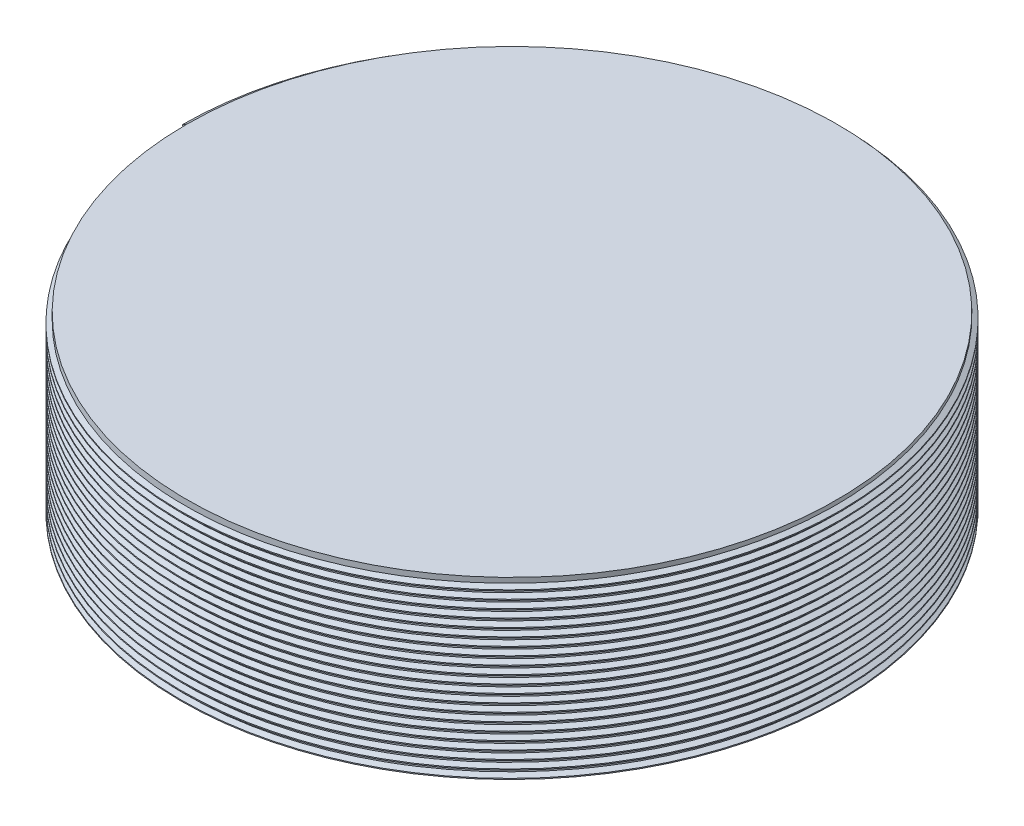
from build123d import *

# Parameters (mm, degrees)
SKETCH1_R                     = 23.9
BOSS_EXTRUDE1_DEPTH           = 12.7
MINCOLWIDTH_ONTRACKING1_PITCH = 0.6


with BuildPart() as part:
    # Sketch1 → Boss-Extrude1 (new body)
    with BuildSketch(Plane(origin=(0, 0, 0), x_dir=(1, 0, 0), z_dir=(0, 1, 0))):
        with Locations(Location((0, 0, 0), (0, 0, 270))):
            Circle(SKETCH1_R)
    extrude(amount=BOSS_EXTRUDE1_DEPTH)

    # MinColWidth_OnTracking1: the profile of HeaderRowsCount1 profile screwed along a right-hand helix of 21.166667 turns, 6 arcs to a turn; built about Z, then put on its axis
    mincolwidth_ontracking1_z = Axis((0, 0, 0), (0, 0, 1))
    mincolwidth_ontracking1_corners = [(23.8997, 0, -0.000173205), (24.224759525, 0, 0.187499999), (24.224759525, 0, 0.262499999), (23.8997, 0, 0.450173203)]
    with BuildLine(mode=Mode.PRIVATE) as mincolwidth_ontracking1_profile:
        Line(mincolwidth_ontracking1_corners[0], mincolwidth_ontracking1_corners[1])
        Line(mincolwidth_ontracking1_corners[1], mincolwidth_ontracking1_corners[2])
        Line(mincolwidth_ontracking1_corners[2], mincolwidth_ontracking1_corners[3])
        Line(mincolwidth_ontracking1_corners[3], mincolwidth_ontracking1_corners[0])
    mincolwidth_ontracking1_cap = Face(mincolwidth_ontracking1_profile.wire())
    mincolwidth_ontracking1_turn_angles = [0, 30, 60, 90, 120, 150, 180, 210, 240, 270, 300, 330, 360]
    mincolwidth_ontracking1_turn_weights = [1, 0.8660254037844387, 1, 0.8660254037844387, 1, 0.8660254037844387, 1, 0.8660254037844387, 1, 0.8660254037844387, 1, 0.8660254037844387, 1]
    mincolwidth_ontracking1_turn_rails = [Edge.make_bspline([Vector(p[0], p[1], 0).rotate(mincolwidth_ontracking1_z, mincolwidth_ontracking1_turn_angles[k]) / mincolwidth_ontracking1_turn_weights[k] + Vector(0, 0, p[2] + MINCOLWIDTH_ONTRACKING1_PITCH * mincolwidth_ontracking1_turn_angles[k] / 360) for k in range(13)], [0, 0, 0, 1, 1, 2, 2, 3, 3, 4, 4, 5, 5, 6, 6, 6], 2, mincolwidth_ontracking1_turn_weights) for p in mincolwidth_ontracking1_corners]
    mincolwidth_ontracking1_turn_sides = [Face.make_surface_from_curves(mincolwidth_ontracking1_turn_rails[p[0]], mincolwidth_ontracking1_turn_rails[p[1]]) for p in [(0, 1), (1, 2), (2, 3), (3, 0)]]
    mincolwidth_ontracking1_last_angles = [7560, 7590, 7620]
    mincolwidth_ontracking1_last_weights = [1, 0.8660254037844387, 1]
    mincolwidth_ontracking1_last_rails = [Edge.make_bspline([Vector(p[0], p[1], 0).rotate(mincolwidth_ontracking1_z, mincolwidth_ontracking1_last_angles[k]) / mincolwidth_ontracking1_last_weights[k] + Vector(0, 0, p[2] + MINCOLWIDTH_ONTRACKING1_PITCH * mincolwidth_ontracking1_last_angles[k] / 360) for k in range(3)], [0, 0, 0, 1, 1, 1], 2, mincolwidth_ontracking1_last_weights) for p in mincolwidth_ontracking1_corners]
    mincolwidth_ontracking1_last_sides = [Face.make_surface_from_curves(mincolwidth_ontracking1_last_rails[p[0]], mincolwidth_ontracking1_last_rails[p[1]]) for p in [(0, 1), (1, 2), (2, 3), (3, 0)]]
    mincolwidth_ontracking1 = Plane(origin=(0, 12.7, 0), x_dir=(-1, 0, 0), z_dir=(0, -1, 0)) * Solid(Shell([*[p.moved(Location((0, 0, MINCOLWIDTH_ONTRACKING1_PITCH * i))) for i in range(21) for p in mincolwidth_ontracking1_turn_sides], *mincolwidth_ontracking1_last_sides, mincolwidth_ontracking1_cap, mincolwidth_ontracking1_cap.rotate(mincolwidth_ontracking1_z, 7620).moved(Location((0, 0, MINCOLWIDTH_ONTRACKING1_PITCH * 7620 / 360)))]))
    add(mincolwidth_ontracking1)


solid = part.part
